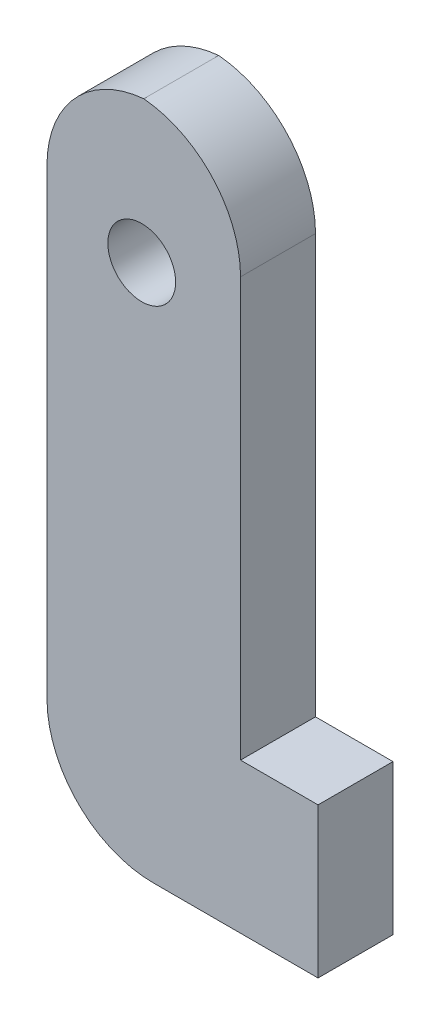
from build123d import *

# Parameters (mm, degrees)
SKETCH1_R           = 2.8702
BOSS_EXTRUDE1_DEPTH = 6.35
FILLET1_R           = 9
FILLET2_R           = 9


with BuildPart() as part:
    # Sketch1 → Boss-Extrude1 (new body)
    with BuildSketch(Plane.XY):
        Polygon((-38.642090152, 26.982634823), (-45.206950064, 26.982634823), (-45.206950064, 71.432634823), (-61.6, 71.432634823), (-61.6, 14.282634823), (-45.206950064, 14.282634823), (-38.642090152, 14.282634823), align=None)
        with Locations((-53.575, 59.289941788)):
            Circle(SKETCH1_R, mode=Mode.SUBTRACT)
    extrude(amount=BOSS_EXTRUDE1_DEPTH)

    # Fillet1
    # the kernel refuses this fillet: 9 mm, written as the material it takes off along each edge
    with BuildSketch(Plane(origin=(-45.206950064, 71.432634823, -22.5), x_dir=(-1, 0, 0), z_dir=(0, 0, 1)), Plane(origin=(-61.6, 71.432634823, -22.5), x_dir=(0, -1, 0), z_dir=(0, 0, 1))) as fillet1_piece_1:
        with BuildLine():
            CenterArc((FILLET1_R, FILLET1_R), FILLET1_R, 180, 90)
            Line((0, FILLET1_R), (0, 0))
            Line((0, 0), (FILLET1_R, 0))
        make_face()
    extrude(amount=51.35, mode=Mode.SUBTRACT)

    # Fillet2
    fillet2_edges = [part.edges().sort_by_distance(p)[0] for p in [
        (-61.6, 14.282634823, 3.175),
    ]]
    fillet(fillet2_edges, radius=FILLET2_R)


solid = part.part
